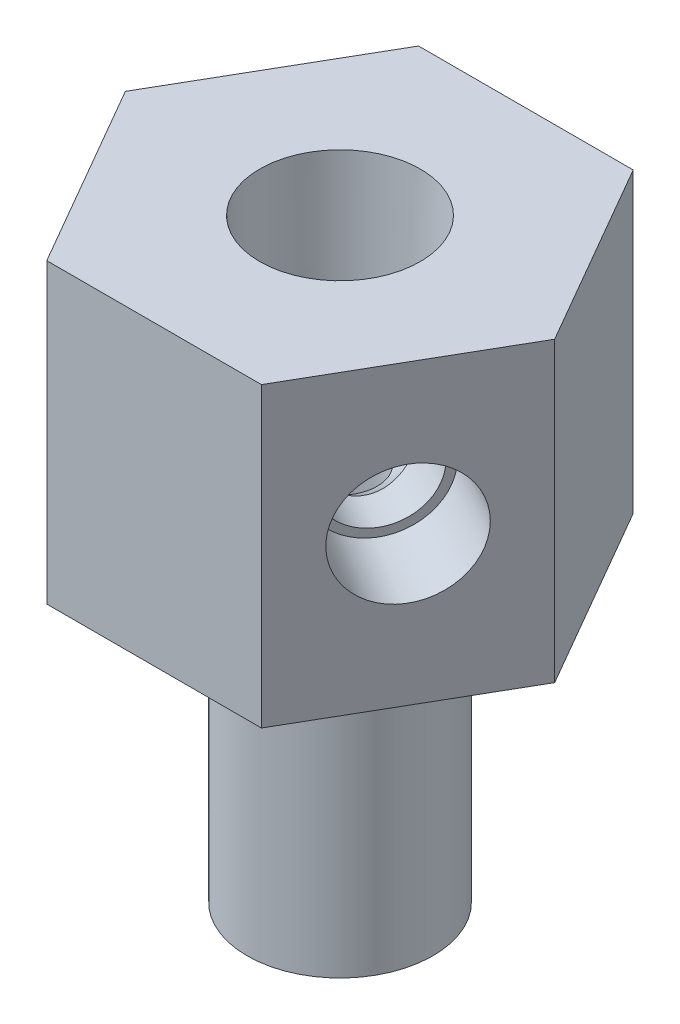
from build123d import *
from OCP.BRepAlgoAPI import BRepAlgoAPI_Cut
from OCP.TopTools import TopTools_ListOfShape

# Parameters (mm, degrees)
SKETCH1_R           = 7.9375
BOSS_EXTRUDE1_DEPTH = 25.4
BOSS_EXTRUDE2_DEPTH = 25.4
SKETCH3_R           = 3.175
CUT_EXTRUDE1_DEPTH  = 57.290998022
SKETCH6_R           = 6.6675
CUT_EXTRUDE2_DEPTH  = 2.38125


with BuildPart() as part:
    # Sketch1 → Boss-Extrude1 (new body)
    with BuildSketch(Plane(origin=(0, 0, 0), x_dir=(1, 0, 0), z_dir=(0, 1, 0))):
        Circle(SKETCH1_R)
    extrude(amount=BOSS_EXTRUDE1_DEPTH)

    # Sketch2 → Boss-Extrude2 (add)
    with BuildSketch(Plane(origin=(0, 25.4, 0), x_dir=(1, 0, 0), z_dir=(0, 1, 0))):
        Polygon((18.330871047, 0), (9.165435523, 15.875), (-9.165435523, 15.875), (-18.330871047, 0), (-9.165435523, -15.875), (9.165435523, -15.875), align=None)
    extrude(amount=BOSS_EXTRUDE2_DEPTH)

    # Sketch3 → Cut-Extrude1 (cut, through all)
    with BuildSketch(Plane.XZ):
        Circle(SKETCH3_R)
    extrude(amount=-CUT_EXTRUDE1_DEPTH, mode=Mode.SUBTRACT)

    # Sketch6 → Cut-Extrude2 (cut)
    with BuildSketch(Plane.XZ.offset(-25.4)):
        Polygon((-18.330871047, 0), (-9.165435523, 15.875), (9.165435523, 15.875), (18.330871047, 0), (9.165435523, -15.875), (-9.165435523, -15.875), align=None)
        Circle(SKETCH6_R, mode=Mode.SUBTRACT)
    extrude(amount=CUT_EXTRUDE2_DEPTH, mode=Mode.SUBTRACT)

    # Sketch4 → 1/4 NPT Tapped Hole1 (revolve, cut)
    with BuildSketch(Plane(origin=(0, 50.8, 0), x_dir=(0, 0, 1), z_dir=(1, 0, 0))):
        Polygon((0, 0), (0, 20.360347279), (5.5626, 17.018), (5.5626, 9.906), (6.557984794, 9.906), (6.8545837, 0), align=None)
    revolve(axis=Axis((0, 57.15, 0), (0, -1, 0)), mode=Mode.SUBTRACT)


with BuildPart() as f_1_8_npt_tapped_hole1_tool:
    # Sketch9 → 1/8 NPT Tapped Hole1 (revolve)
    with BuildSketch(Plane(origin=(13.748230523, 38.1, 7.937366219), x_dir=(0.4999999999999996, 0, -0.8660254037844388), z_dir=(0, 1, 0))):
        Polygon((0, 0), (0, 14.217468714), (4.2164, 11.684), (4.2164, 6.858), (4.936181096, 6.858), (5.1415188, 0), align=None)
    revolve(axis=Axis((19.247491837, 38.1, 11.112366219), (-0.8660254037844389, 0, -0.49999999999999956)))


with BuildPart() as part_1:
    add(part.part)

    # 1/8 NPT Tapped Hole1: cut by f_1_8_npt_tapped_hole1_tool, with a tolerance
    f_1_8_npt_tapped_hole1_stock = TopTools_ListOfShape()
    f_1_8_npt_tapped_hole1_stock.Append(part_1.part.wrapped)
    f_1_8_npt_tapped_hole1_tools = TopTools_ListOfShape()
    f_1_8_npt_tapped_hole1_tools.Append(f_1_8_npt_tapped_hole1_tool.part.wrapped)
    f_1_8_npt_tapped_hole1_cut = BRepAlgoAPI_Cut()
    f_1_8_npt_tapped_hole1_cut.SetArguments(f_1_8_npt_tapped_hole1_stock)
    f_1_8_npt_tapped_hole1_cut.SetTools(f_1_8_npt_tapped_hole1_tools)
    f_1_8_npt_tapped_hole1_cut.SetFuzzyValue(0.00001)
    f_1_8_npt_tapped_hole1_cut.Build()
    add(Compound.cast(f_1_8_npt_tapped_hole1_cut.Shape()).solids(), mode=Mode.REPLACE)


with BuildPart() as f_1_8_npt_tapped_hole1_at_2_tool:
    # Sketch9 at point 2 (carried to point 2, square into its face) → 1/8 NPT Tapped Hole1 at 2 (revolve)
    with BuildSketch(Plane(origin=(-0.000154477, 38.1, -15.875), x_dir=(-1, 0, 0), z_dir=(0, 1, 0))):
        Polygon((0, 0), (0, 14.217468714), (4.2164, 11.684), (4.2164, 6.858), (4.936181096, 6.858), (5.1415188, 0), align=None)
    revolve(axis=Axis((-0.000154477, 38.1, -22.225), (0, 0, 1)))


with BuildPart() as part_2:
    add(part_1.part)

    # 1/8 NPT Tapped Hole1 at 2: cut by f_1_8_npt_tapped_hole1_at_2_tool, with a tolerance
    f_1_8_npt_tapped_hole1_at_2_stock = TopTools_ListOfShape()
    f_1_8_npt_tapped_hole1_at_2_stock.Append(part_2.part.wrapped)
    f_1_8_npt_tapped_hole1_at_2_tools = TopTools_ListOfShape()
    f_1_8_npt_tapped_hole1_at_2_tools.Append(f_1_8_npt_tapped_hole1_at_2_tool.part.wrapped)
    f_1_8_npt_tapped_hole1_at_2_cut = BRepAlgoAPI_Cut()
    f_1_8_npt_tapped_hole1_at_2_cut.SetArguments(f_1_8_npt_tapped_hole1_at_2_stock)
    f_1_8_npt_tapped_hole1_at_2_cut.SetTools(f_1_8_npt_tapped_hole1_at_2_tools)
    f_1_8_npt_tapped_hole1_at_2_cut.SetFuzzyValue(0.00001)
    f_1_8_npt_tapped_hole1_at_2_cut.Build()
    add(Compound.cast(f_1_8_npt_tapped_hole1_at_2_cut.Shape()).solids(), mode=Mode.REPLACE)


with BuildPart() as f_1_8_npt_tapped_hole1_at_3_tool:
    # Sketch9 at point 3 (carried to point 3, square into its face) → 1/8 NPT Tapped Hole1 at 3 (revolve)
    with BuildSketch(Plane(origin=(-13.748076047, 38.1, 7.937633781), x_dir=(0.500000175, 0, 0.866025303), z_dir=(0, 1, 0))):
        Polygon((0, 0), (0, 14.217468714), (4.2164, 11.684), (4.2164, 6.858), (4.936181096, 6.858), (5.1415188, 0), align=None)
    revolve(axis=Axis((-19.24733672, 38.1, 11.112634891), (0.866025303, 0, -0.500000175)))


with BuildPart() as part_3:
    add(part_2.part)

    # 1/8 NPT Tapped Hole1 at 3: cut by f_1_8_npt_tapped_hole1_at_3_tool, with a tolerance
    f_1_8_npt_tapped_hole1_at_3_stock = TopTools_ListOfShape()
    f_1_8_npt_tapped_hole1_at_3_stock.Append(part_3.part.wrapped)
    f_1_8_npt_tapped_hole1_at_3_tools = TopTools_ListOfShape()
    f_1_8_npt_tapped_hole1_at_3_tools.Append(f_1_8_npt_tapped_hole1_at_3_tool.part.wrapped)
    f_1_8_npt_tapped_hole1_at_3_cut = BRepAlgoAPI_Cut()
    f_1_8_npt_tapped_hole1_at_3_cut.SetArguments(f_1_8_npt_tapped_hole1_at_3_stock)
    f_1_8_npt_tapped_hole1_at_3_cut.SetTools(f_1_8_npt_tapped_hole1_at_3_tools)
    f_1_8_npt_tapped_hole1_at_3_cut.SetFuzzyValue(0.00001)
    f_1_8_npt_tapped_hole1_at_3_cut.Build()
    add(Compound.cast(f_1_8_npt_tapped_hole1_at_3_cut.Shape()).solids(), mode=Mode.REPLACE)


solid = part_3.part
